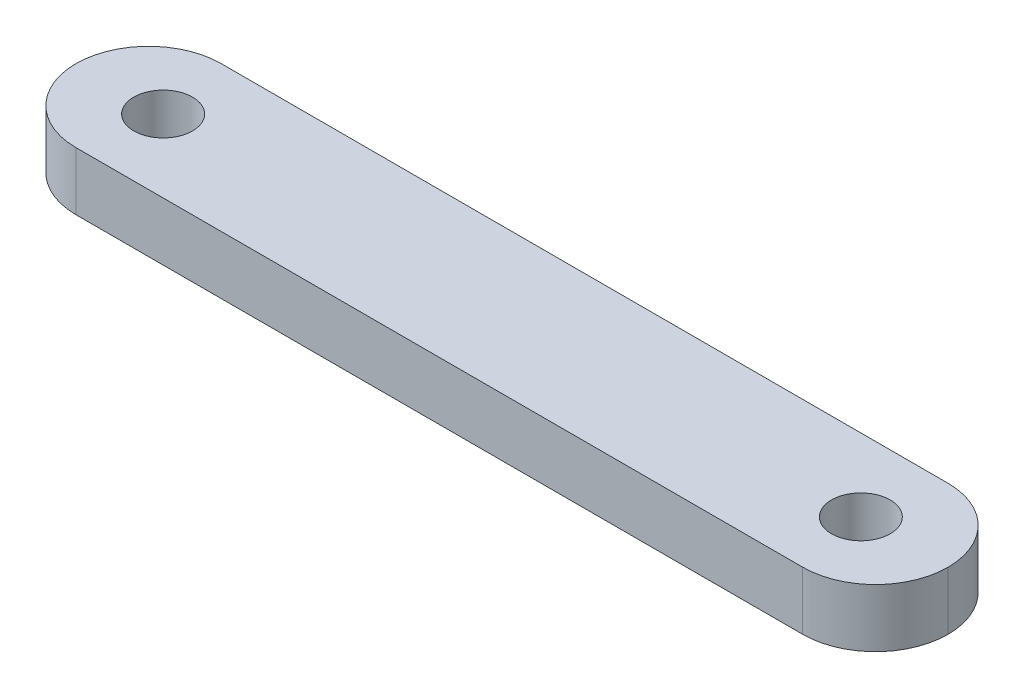
from build123d import *

# Parameters (mm, degrees)
SKETCH_1_W          = 150
SKETCH_1_H          = 25
EXTRUDE_2_DEPTH     = 10
SKETCH_5_R          = 5.05
CUT_EXTRUDE_4_DEPTH = 77.689308251
FILLET_1_R          = 12.5


with BuildPart() as part:
    # Эскиз1 → Бобышка-Вытянуть2 (new body)
    with BuildSketch(Plane(origin=(0, 0, 0), x_dir=(1, 0, 0), z_dir=(0, 1, 0))):
        Rectangle(SKETCH_1_W, SKETCH_1_H)
    extrude(amount=EXTRUDE_2_DEPTH)

    # Эскиз5 → Вырез-Вытянуть4 (cut, through all)
    with BuildSketch(Plane(origin=(0, 10, 0), x_dir=(1, 0, 0), z_dir=(0, 1, 0))):
        with Locations(Location((-60, 0, 0), (0, 0, 270))):
            Circle(SKETCH_5_R)
    cut_extrude_4 = extrude(amount=-CUT_EXTRUDE_4_DEPTH, mode=Mode.SUBTRACT)

    # Зеркальное отражение1: Вырез-Вытянуть4 across plane
    add(cut_extrude_4.mirror(Plane(origin=(0, 0, 0), x_dir=(0, 0, 1), z_dir=(1, 0, 0))), mode=Mode.SUBTRACT)

    # Скругление1
    fillet_1_edges = [part.edges().sort_by_distance(p)[0] for p in [
        (-75, 5, 12.5),
        (-75, 5, -12.5),
        (75, 5, 12.5),
        (75, 5, -12.5),
    ]]
    fillet(fillet_1_edges, radius=FILLET_1_R - 0.0001)  # a hair under: the kernel refuses the full size


solid = part.part
